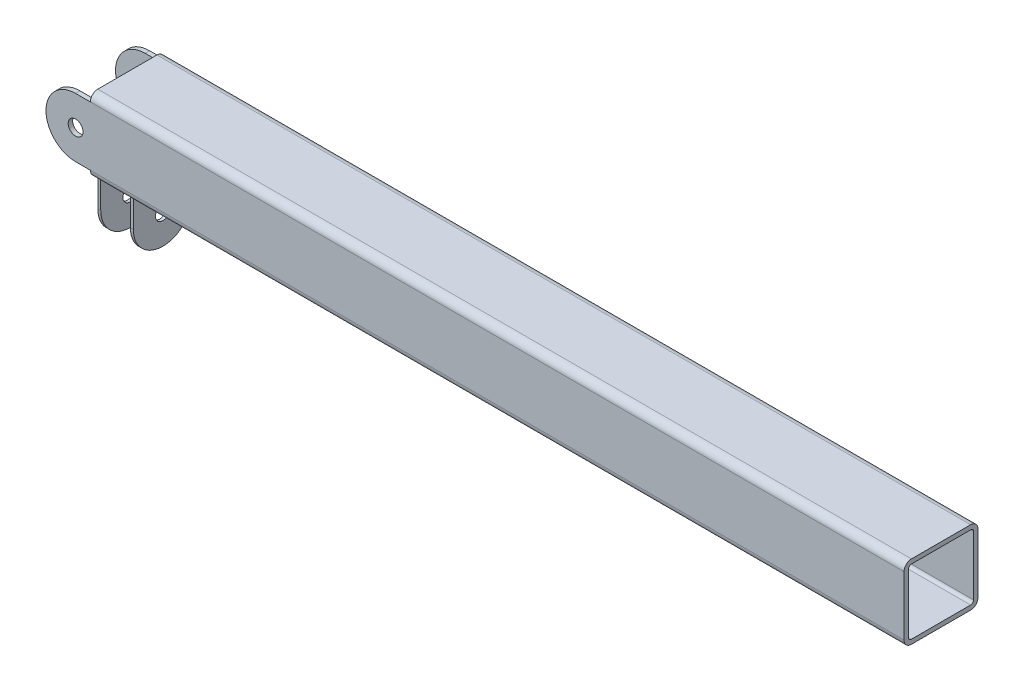
from build123d import *

# Parameters (mm, degrees)
EXTRUDE_THIN1_DEPTH   = 550
SKETCH3_R             = 5
BOSS_EXTRUDE2_DEPTH   = 3
BOSS_EXTRUDE3_START   = -47
SKETCH3_3_R           = 5
BOSS_EXTRUDE3_DEPTH   = 3
SKETCH5_W             = 2
SKETCH5_H             = 40
BOSS_EXTRUDE4_DEPTH   = 40
BOSS_EXTRUDE4_2_DEPTH = 40
FILLET1_R             = 20
FILLET2_R             = 20
SKETCH6_R             = 5
CUT_EXTRUDE2_DEPTH    = 555.391558377


with BuildPart() as part:
    # Sketch1 → Extrude-Thin1 (new body)
    with BuildSketch(Plane(origin=(0, 0, 0), x_dir=(0, 0, -1), z_dir=(1, 0, 0))):
        with BuildLine():
            Line((-25, 20), (-25, -20))
            ThreePointArc((-25, -20), (-23.535533906, -23.535533906), (-20, -25))
            Line((-20, -25), (20, -25))
            ThreePointArc((20, -25), (23.535533906, -23.535533906), (25, -20))
            Line((25, -20), (25, 20))
            ThreePointArc((25, 20), (23.535533906, 23.535533906), (20, 25))
            Line((20, 25), (-20, 25))
            ThreePointArc((-20, 25), (-23.535533906, 23.535533906), (-25, 20))
        make_face()
        with BuildLine():
            Line((-22, 20), (-22, -20))
            ThreePointArc((-22, -20), (-21.414213562, -21.414213562), (-20, -22))
            Line((-20, -22), (20, -22))
            ThreePointArc((20, -22), (21.414213562, -21.414213562), (22, -20))
            Line((22, -20), (22, 20))
            ThreePointArc((22, 20), (21.414213562, 21.414213562), (20, 22))
            Line((20, 22), (-20, 22))
            ThreePointArc((-20, 22), (-21.414213562, 21.414213562), (-22, 20))
        make_face(mode=Mode.SUBTRACT)
    extrude(amount=EXTRUDE_THIN1_DEPTH)

    # Sketch3 → Boss-Extrude2 (add)
    with BuildSketch(Plane(origin=(0, 0, -25), x_dir=(-1, 0, 0), z_dir=(0, 0, -1))):
        with BuildLine():
            Line((0, 20), (10, 20))
            ThreePointArc((10, 20), (30, 0), (10, -20))
            Line((10, -20), (0, -20))
            Line((0, -20), (0, 20))
        make_face()
        with Locations((10, 0)):
            Circle(SKETCH3_R, mode=Mode.SUBTRACT)
    extrude(amount=-BOSS_EXTRUDE2_DEPTH)

    # Sketch3<3> → Boss-Extrude3 (add)
    with BuildSketch(Plane(origin=(0, 0, -25), x_dir=(-1, 0, 0), z_dir=(0, 0, -1)).offset(BOSS_EXTRUDE3_START)):
        with BuildLine():
            Line((0, 20), (10, 20))
            ThreePointArc((10, 20), (30, 0), (10, -20))
            Line((10, -20), (0, -20))
            Line((0, -20), (0, 20))
        make_face()
        with Locations((10, 0)):
            Circle(SKETCH3_3_R, mode=Mode.SUBTRACT)
    extrude(amount=-BOSS_EXTRUDE3_DEPTH)


with BuildPart() as body_2:
    # Sketch5 → Boss-Extrude4 (new body)
    with BuildSketch(Plane(origin=(0, -25, 0), x_dir=(-1, 0, 0), z_dir=(0, -1, 0))):
        with Locations((-23, 0)):
            Rectangle(SKETCH5_W, SKETCH5_H)
    extrude(amount=BOSS_EXTRUDE4_DEPTH)

    # Fillet1
    fillet1_edges = [body_2.edges().sort_by_distance(p)[0] for p in [
        (23, -65, -20),
        (23, -65, 20),
    ]]
    fillet(fillet1_edges, radius=FILLET1_R - 0.0001)  # a hair under: the kernel refuses the full size


with BuildPart() as body_3:
    # Sketch5 → Boss-Extrude4 2 (new body)
    with BuildSketch(Plane(origin=(0, -25, 0), x_dir=(-1, 0, 0), z_dir=(0, -1, 0))):
        with Locations((-1, 0)):
            Rectangle(SKETCH5_W, SKETCH5_H)
    extrude(amount=BOSS_EXTRUDE4_2_DEPTH)

    # Fillet2
    fillet2_edges = [body_3.edges().sort_by_distance(p)[0] for p in [
        (1, -65, -20),
        (1, -65, 20),
    ]]
    fillet(fillet2_edges, radius=FILLET2_R - 0.0001)  # a hair under: the kernel refuses the full size


with BuildPart() as cut_extrude2_tool:
    # Sketch6 → Cut-Extrude2 (new, through all)
    with BuildSketch(Plane.ZY):
        with Locations((0, -45)):
            Circle(SKETCH6_R)
    extrude(amount=-CUT_EXTRUDE2_DEPTH)


with BuildPart() as body_2_1:
    add(body_2.part)

    # Cut-Extrude2: cut by cut_extrude2_tool
    add(cut_extrude2_tool.part, mode=Mode.SUBTRACT)


with BuildPart() as body_3_1:
    add(body_3.part)

    # Cut-Extrude2: cut by cut_extrude2_tool
    add(cut_extrude2_tool.part, mode=Mode.SUBTRACT)


solid = Compound([part.part, body_2_1.part, body_3_1.part])
